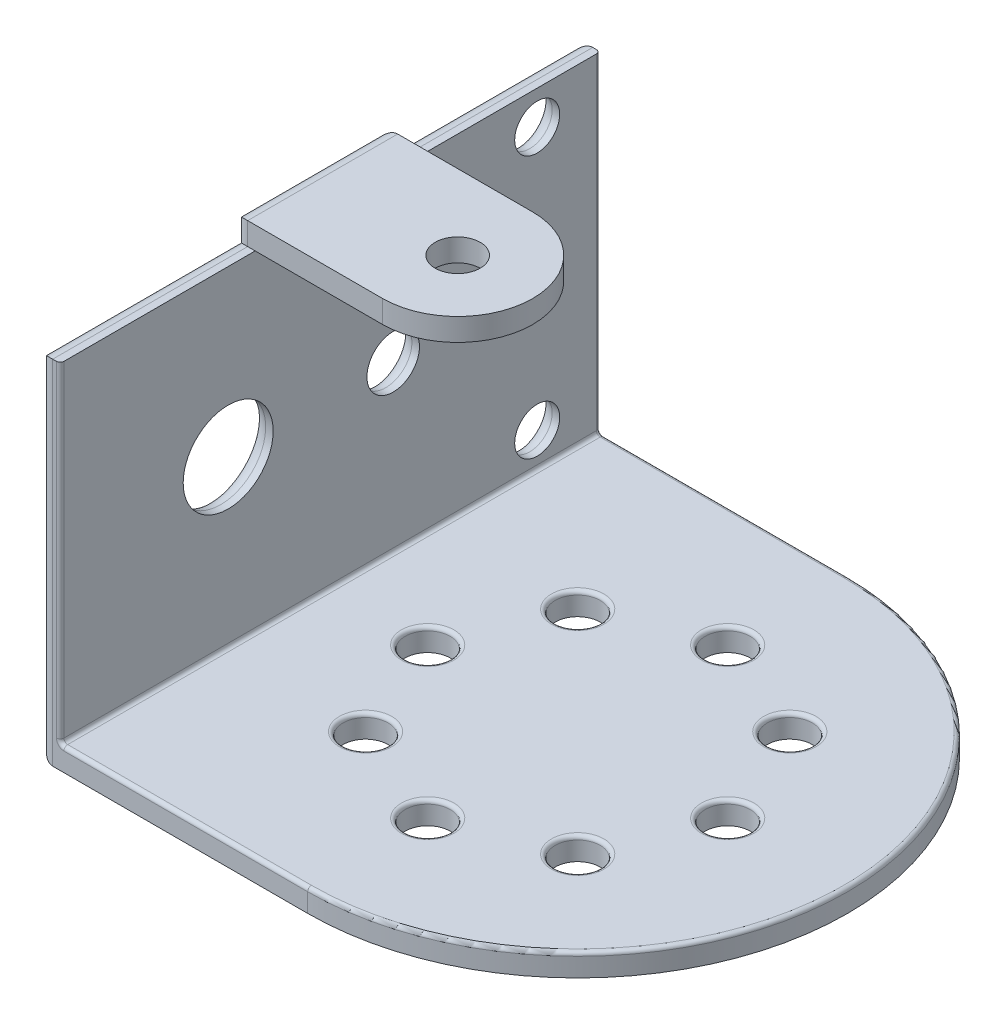
from build123d import *

# Parameters (mm, degrees)
CROQUIS1_W              = 36
CROQUIS1_H              = 22
CROQUIS1_R              = 1.5
CROQUIS1_R_2            = 3
CROQUIS1_R_3            = 1.75
SALIENTE_EXTRUIR1_DEPTH = 1.5
SALIENTE_EXTRUIR3_DEPTH = 1.5
SALIENTE_EXTRUIR4_DEPTH = 1.5
CORTAR_EXTRUIR1_REACH   = 49.381
CROQUIS5_R              = 1.5
CORTAR_EXTRUIR2_REACH   = 49.381
CROQUIS7_R              = 1.5
REDONDEO2_R             = 1
REDONDEO3_R             = 0.25


with BuildPart() as part:
    # Croquis1 → Saliente-Extruir1 (new body)
    with BuildSketch(Plane(origin=(0, 0, 0), x_dir=(0, 0, -1), z_dir=(1, 0, 0))):
        Rectangle(CROQUIS1_W, CROQUIS1_H)
        with Locations((13.8, 8.75)):
            Circle(CROQUIS1_R, mode=Mode.SUBTRACT)
        with Locations((-6.8, 0)):
            Circle(CROQUIS1_R_2, mode=Mode.SUBTRACT)
        with Locations(Location((13.8, -8.75, 0), (0, 0, 180))):
            Circle(CROQUIS1_R, mode=Mode.SUBTRACT)
        with Locations((4.2, 0)):
            Circle(CROQUIS1_R_3, mode=Mode.SUBTRACT)
    extrude(amount=SALIENTE_EXTRUIR1_DEPTH)

    # Croquis3<2> → Saliente-Extruir3 (add)
    with BuildSketch(Plane.XZ.offset(11)):
        with BuildLine():
            Line((18, -18), (0, -18))
            Line((0, -18), (0, 18))
            Line((0, 18), (18, 18))
            ThreePointArc((18, 18), (36, 0), (18, -18))
        make_face()
    extrude(amount=SALIENTE_EXTRUIR3_DEPTH)

    # Croquis4 → Saliente-Extruir4 (add)
    with BuildSketch(Plane(origin=(0, 11, 0), x_dir=(1, 0, 0), z_dir=(0, 1, 0))):
        with BuildLine():
            Line((10, 5), (0, 5))
            Line((0, 5), (0, -5))
            Line((0, -5), (10, -5))
            ThreePointArc((10, -5), (15, 0), (10, 5))
        make_face()
    extrude(amount=SALIENTE_EXTRUIR4_DEPTH)

    # Croquis5 → Cortar-Extruir1 (cut, up to next)
    with BuildSketch(Plane(origin=(0, 12.5, 0), x_dir=(1, 0, 0), z_dir=(0, 1, 0)), mode=Mode.PRIVATE) as cortar_extruir1_sk1:
        with Locations(Location((10, 0, 0), (0, 0, 270))):
            Circle(CROQUIS5_R)
    cortar_extruir1_tool1 = extrude(cortar_extruir1_sk1.sketch, amount=-CORTAR_EXTRUIR1_REACH, mode=Mode.PRIVATE) & part.part
    add(cortar_extruir1_tool1.solids().sort_by_distance((10, 12.5, 0))[0], mode=Mode.SUBTRACT)

    # Croquis7 → Cortar-Extruir2 (cut, up to next)
    with BuildSketch(Plane.XZ.offset(12.5), mode=Mode.PRIVATE) as cortar_extruir2_sk1:
        with Locations(Location((28, 0, 0), (0, 0, 270))):
            Circle(CROQUIS7_R)
    cortar_extruir2_tool1 = extrude(cortar_extruir2_sk1.sketch, amount=-CORTAR_EXTRUIR2_REACH, mode=Mode.PRIVATE) & part.part
    # Croquis7 → Cortar-Extruir2 (cut, up to next)
    with BuildSketch(Plane.XZ.offset(12.5), mode=Mode.PRIVATE) as cortar_extruir2_sk2:
        with Locations(Location((25.071067812, -7.071067812, 0), (0, 0, 270))):
            Circle(CROQUIS7_R)
    cortar_extruir2_tool2 = extrude(cortar_extruir2_sk2.sketch, amount=-CORTAR_EXTRUIR2_REACH, mode=Mode.PRIVATE) & part.part
    # Croquis7 → Cortar-Extruir2 (cut, up to next)
    with BuildSketch(Plane.XZ.offset(12.5), mode=Mode.PRIVATE) as cortar_extruir2_sk3:
        with Locations(Location((18, -10, 0), (0, 0, 270))):
            Circle(CROQUIS7_R)
    cortar_extruir2_tool3 = extrude(cortar_extruir2_sk3.sketch, amount=-CORTAR_EXTRUIR2_REACH, mode=Mode.PRIVATE) & part.part
    # Croquis7 → Cortar-Extruir2 (cut, up to next)
    with BuildSketch(Plane.XZ.offset(12.5), mode=Mode.PRIVATE) as cortar_extruir2_sk4:
        with Locations(Location((10.928932188, -7.071067812, 0), (0, 0, 270))):
            Circle(CROQUIS7_R)
    cortar_extruir2_tool4 = extrude(cortar_extruir2_sk4.sketch, amount=-CORTAR_EXTRUIR2_REACH, mode=Mode.PRIVATE) & part.part
    # Croquis7 → Cortar-Extruir2 (cut, up to next)
    with BuildSketch(Plane.XZ.offset(12.5), mode=Mode.PRIVATE) as cortar_extruir2_sk5:
        with Locations(Location((8, 0, 0), (0, 0, 270))):
            Circle(CROQUIS7_R)
    cortar_extruir2_tool5 = extrude(cortar_extruir2_sk5.sketch, amount=-CORTAR_EXTRUIR2_REACH, mode=Mode.PRIVATE) & part.part
    # Croquis7 → Cortar-Extruir2 (cut, up to next)
    with BuildSketch(Plane.XZ.offset(12.5), mode=Mode.PRIVATE) as cortar_extruir2_sk6:
        with Locations(Location((10.928932188, 7.071067812, 0), (0, 0, 270))):
            Circle(CROQUIS7_R)
    cortar_extruir2_tool6 = extrude(cortar_extruir2_sk6.sketch, amount=-CORTAR_EXTRUIR2_REACH, mode=Mode.PRIVATE) & part.part
    # Croquis7 → Cortar-Extruir2 (cut, up to next)
    with BuildSketch(Plane.XZ.offset(12.5), mode=Mode.PRIVATE) as cortar_extruir2_sk7:
        with Locations(Location((18, 10, 0), (0, 0, 270))):
            Circle(CROQUIS7_R)
    cortar_extruir2_tool7 = extrude(cortar_extruir2_sk7.sketch, amount=-CORTAR_EXTRUIR2_REACH, mode=Mode.PRIVATE) & part.part
    # Croquis7 → Cortar-Extruir2 (cut, up to next)
    with BuildSketch(Plane.XZ.offset(12.5), mode=Mode.PRIVATE) as cortar_extruir2_sk8:
        with Locations(Location((25.071067812, 7.071067812, 0), (0, 0, 270))):
            Circle(CROQUIS7_R)
    cortar_extruir2_tool8 = extrude(cortar_extruir2_sk8.sketch, amount=-CORTAR_EXTRUIR2_REACH, mode=Mode.PRIVATE) & part.part
    add(cortar_extruir2_tool1.solids().sort_by_distance((28, -12.5, 0))[0], mode=Mode.SUBTRACT)
    add(cortar_extruir2_tool2.solids().sort_by_distance((25.071068, -12.5, -7.071068))[0], mode=Mode.SUBTRACT)
    add(cortar_extruir2_tool3.solids().sort_by_distance((18, -12.5, -10))[0], mode=Mode.SUBTRACT)
    add(cortar_extruir2_tool4.solids().sort_by_distance((10.928932, -12.5, -7.071068))[0], mode=Mode.SUBTRACT)
    add(cortar_extruir2_tool5.solids().sort_by_distance((8, -12.5, 0))[0], mode=Mode.SUBTRACT)
    add(cortar_extruir2_tool6.solids().sort_by_distance((10.928932, -12.5, 7.071068))[0], mode=Mode.SUBTRACT)
    add(cortar_extruir2_tool7.solids().sort_by_distance((18, -12.5, 10))[0], mode=Mode.SUBTRACT)
    add(cortar_extruir2_tool8.solids().sort_by_distance((25.071068, -12.5, 7.071068))[0], mode=Mode.SUBTRACT)

    # Redondeo2
    # the kernel refuses this fillet: 1 mm, written as the material it takes off along each edge
    with BuildSketch(Plane(origin=(0, 8.75, -13.8), x_dir=(0, 0, -1), z_dir=(0, -1, 0))) as redondeo2_piece_1:
        with BuildLine():
            CenterArc((1.5 + REDONDEO2_R, REDONDEO2_R), REDONDEO2_R, 180, 90)
            Line((1.5, REDONDEO2_R), (1.5, 0))
            Line((1.5, 0), (1.5 + REDONDEO2_R, 0))
        make_face()
    revolve(axis=Axis((0, 8.75, -13.8), (1, 0, 0)), mode=Mode.SUBTRACT)
    with BuildSketch(Plane(origin=(0, 0, 6.8), x_dir=(0, 0, -1), z_dir=(0, -1, 0))) as redondeo2_piece_2:
        with BuildLine():
            CenterArc((3 + REDONDEO2_R, REDONDEO2_R), REDONDEO2_R, 180, 90)
            Line((3, REDONDEO2_R), (3, 0))
            Line((3, 0), (3 + REDONDEO2_R, 0))
        make_face()
    revolve(axis=Axis((0, 0, 6.8), (1, 0, 0)), mode=Mode.SUBTRACT)
    with BuildSketch(Plane(origin=(0, -8.75, -13.8), x_dir=(0, 0, 1), z_dir=(0, 1, 0))) as redondeo2_piece_3:
        with BuildLine():
            CenterArc((1.5 + REDONDEO2_R, REDONDEO2_R), REDONDEO2_R, 180, 90)
            Line((1.5, REDONDEO2_R), (1.5, 0))
            Line((1.5, 0), (1.5 + REDONDEO2_R, 0))
        make_face()
    revolve(axis=Axis((0, -8.75, -13.8), (1, 0, 0)), mode=Mode.SUBTRACT)
    with BuildSketch(Plane(origin=(0, 0, -4.2), x_dir=(0, 0, -1), z_dir=(0, -1, 0))) as redondeo2_piece_4:
        with BuildLine():
            CenterArc((1.75 + REDONDEO2_R, REDONDEO2_R), REDONDEO2_R, 180, 90)
            Line((1.75, REDONDEO2_R), (1.75, 0))
            Line((1.75, 0), (1.75 + REDONDEO2_R, 0))
        make_face()
    revolve(axis=Axis((0, 0, -4.2), (1, 0, 0)), mode=Mode.SUBTRACT)
    with BuildSketch(Plane(origin=(0, -12.5, -20.5), x_dir=(0, 1, 0), z_dir=(0, 0, 1))) as redondeo2_piece_5:
        with BuildLine():
            CenterArc((REDONDEO2_R, -REDONDEO2_R), REDONDEO2_R, 90, 90)
            Line((0, -REDONDEO2_R), (0, 0))
            Line((0, 0), (REDONDEO2_R, 0))
        make_face()
    extrude(amount=41, mode=Mode.SUBTRACT)
    with BuildSketch(Plane(origin=(0, 11, 5), x_dir=(0, -1, 0), z_dir=(0, 0, 1))) as redondeo2_piece_6:
        with BuildLine():
            CenterArc((REDONDEO2_R, REDONDEO2_R), REDONDEO2_R, 180, 90)
            Line((0, REDONDEO2_R), (0, 0))
            Line((0, 0), (REDONDEO2_R, 0))
        make_face()
    extrude(amount=15.5, mode=Mode.SUBTRACT)
    with BuildSketch(Plane(origin=(0, 11, -5), x_dir=(0, 0, 1), z_dir=(0, 1, 0))) as redondeo2_piece_7:
        with BuildLine():
            CenterArc((REDONDEO2_R, REDONDEO2_R), REDONDEO2_R, 180, 90)
            Line((0, REDONDEO2_R), (0, 0))
            Line((0, 0), (REDONDEO2_R, 0))
        make_face()
    extrude(amount=4, mode=Mode.SUBTRACT)
    with BuildSketch(Plane(origin=(0, 11, 5), x_dir=(0, 0, -1), z_dir=(0, 1, 0))) as redondeo2_piece_8:
        with BuildLine():
            CenterArc((REDONDEO2_R, -REDONDEO2_R), REDONDEO2_R, 90, 90)
            Line((0, -REDONDEO2_R), (0, 0))
            Line((0, 0), (REDONDEO2_R, 0))
        make_face()
    extrude(amount=4, mode=Mode.SUBTRACT)
    with BuildSketch(Plane(origin=(0, 12.5, -7.5), x_dir=(0, -1, 0), z_dir=(0, 0, 1))) as redondeo2_piece_9:
        with BuildLine():
            CenterArc((REDONDEO2_R, REDONDEO2_R), REDONDEO2_R, 180, 90)
            Line((0, REDONDEO2_R), (0, 0))
            Line((0, 0), (REDONDEO2_R, 0))
        make_face()
    extrude(amount=15, mode=Mode.SUBTRACT)
    with BuildSketch(Plane(origin=(0, -15, 18), x_dir=(0, 0, -1), z_dir=(0, 1, 0)), Plane(origin=(0, -15, -18), x_dir=(1, 0, 0), z_dir=(0, 1, 0))) as redondeo2_piece_10:
        with BuildLine():
            CenterArc((REDONDEO2_R, -REDONDEO2_R), REDONDEO2_R, 90, 90)
            Line((0, -REDONDEO2_R), (0, 0))
            Line((0, 0), (REDONDEO2_R, 0))
        make_face()
    extrude(amount=28.5, mode=Mode.SUBTRACT)
    with BuildSketch(Plane(origin=(0, 11, -20.5), x_dir=(1, 0, 0), z_dir=(0, 0, 1))) as redondeo2_piece_11:
        with BuildLine():
            CenterArc((REDONDEO2_R, -REDONDEO2_R), REDONDEO2_R, 90, 90)
            Line((0, -REDONDEO2_R), (0, 0))
            Line((0, 0), (REDONDEO2_R, 0))
        make_face()
    extrude(amount=15.5, mode=Mode.SUBTRACT)
    with BuildSketch(Plane(origin=(0, 8.5, 5), x_dir=(0, 0, -1), z_dir=(0, 1, 0))) as redondeo2_piece_12a_section:
        with BuildLine():
            CenterArc((REDONDEO2_R, -REDONDEO2_R), REDONDEO2_R, 90, 90)
            Line((0, -REDONDEO2_R), (0, 0))
            Line((0, 0), (REDONDEO2_R, 0))
        make_face()
    redondeo2_piece_12a = extrude(amount=6.5, mode=Mode.PRIVATE)
    redondeo2_piece_12a = split(redondeo2_piece_12a, bisect_by=Plane(origin=(0.226395114, 11, 4.773604886), z_dir=(0, -1, 0)), keep=Keep.TOP, mode=Mode.PRIVATE)
    with BuildSketch(Plane(origin=(0, 11, 2.5), x_dir=(0, -1, 0), z_dir=(0, 0, 1))) as redondeo2_piece_12b_section:
        with BuildLine():
            CenterArc((REDONDEO2_R, REDONDEO2_R), REDONDEO2_R, 180, 90)
            Line((0, REDONDEO2_R), (0, 0))
            Line((0, 0), (REDONDEO2_R, 0))
        make_face()
    redondeo2_piece_12b = extrude(amount=18, mode=Mode.PRIVATE)
    redondeo2_piece_12b = split(redondeo2_piece_12b, bisect_by=Plane(origin=(0.226395114, 10.773604886, 5), z_dir=(0, 0, -1)), keep=Keep.TOP, mode=Mode.PRIVATE)
    redondeo2_piece_12 = redondeo2_piece_12a & redondeo2_piece_12b
    add(redondeo2_piece_12, mode=Mode.SUBTRACT)
    with BuildSketch(Plane(origin=(0, 11, -20.5), x_dir=(1, 0, 0), z_dir=(0, 0, 1))) as redondeo2_piece_13a_section:
        with BuildLine():
            CenterArc((REDONDEO2_R, -REDONDEO2_R), REDONDEO2_R, 90, 90)
            Line((0, -REDONDEO2_R), (0, 0))
            Line((0, 0), (REDONDEO2_R, 0))
        make_face()
    redondeo2_piece_13a = extrude(amount=18, mode=Mode.PRIVATE)
    redondeo2_piece_13a = split(redondeo2_piece_13a, bisect_by=Plane(origin=(0.226395114, 10.773604886, -5), z_dir=(0, 0, 1)), keep=Keep.TOP, mode=Mode.PRIVATE)
    with BuildSketch(Plane(origin=(0, 8.5, -5), x_dir=(0, 0, 1), z_dir=(0, 1, 0))) as redondeo2_piece_13b_section:
        with BuildLine():
            CenterArc((REDONDEO2_R, REDONDEO2_R), REDONDEO2_R, 180, 90)
            Line((0, REDONDEO2_R), (0, 0))
            Line((0, 0), (REDONDEO2_R, 0))
        make_face()
    redondeo2_piece_13b = extrude(amount=6.5, mode=Mode.PRIVATE)
    redondeo2_piece_13b = split(redondeo2_piece_13b, bisect_by=Plane(origin=(0.226395114, 11, -4.773604886), z_dir=(0, -1, 0)), keep=Keep.TOP, mode=Mode.PRIVATE)
    redondeo2_piece_13 = redondeo2_piece_13a & redondeo2_piece_13b
    add(redondeo2_piece_13, mode=Mode.SUBTRACT)

    # Redondeo3
    redondeo3_edges = [part.edges().sort_by_distance(p)[0] for p in [
        (1.5, 0, 18),
        (1.5, -11, 0),
        (36, -11, 0),
        (9.75, -11, 18),
        (9.75, -11, -18),
        (1.5, 0, -18),
        (25.071067812, -11, 8.571067812),
        (18, -11, 11.5),
        (10.928932188, -11, 8.571067812),
        (8, -11, 1.5),
        (10.928932188, -11, -5.571067812),
        (18, -11, -8.5),
        (25.071067812, -11, -5.571067812),
        (28, -11, 1.5),
    ]]
    fillet(redondeo3_edges, radius=REDONDEO3_R)


solid = part.part
